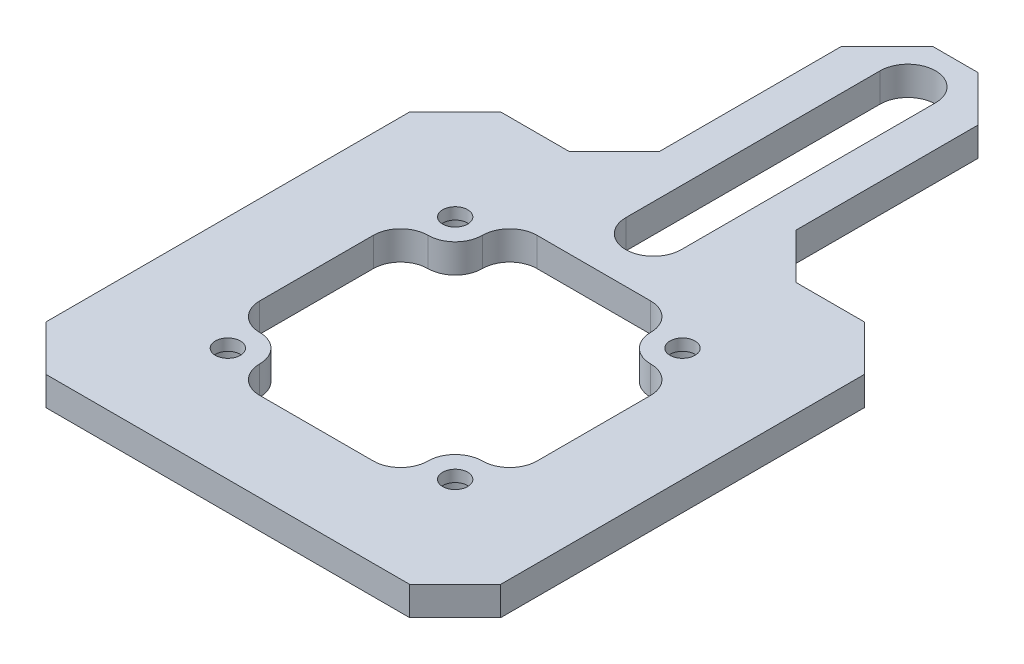
from build123d import *

# Parameters (mm, degrees)
SKETCH2_W           = 50
SKETCH2_H           = 50
BOSS_EXTRUDE1_DEPTH = 3.175
SKETCH3_R           = 1.375
CUT_EXTRUDE1_DEPTH  = 36.497614356
SKETCH5_R           = 2.375
CUT_EXTRUDE3_DEPTH  = 1.9
CUT_EXTRUDE9_DEPTH  = 36.497614356
FILLET1_R           = 3
SKETCH11_W          = 15
SKETCH11_H          = 30
BOSS_EXTRUDE2_DEPTH = 3.175
CUT_EXTRUDE10_REACH = 62.499
CHAMFER1_SIZE       = 5


with BuildPart() as part:
    # Sketch2 → Boss-Extrude1 (new body)
    with BuildSketch(Plane(origin=(0, 0, 0), x_dir=(1, 0, 0), z_dir=(0, 1, 0))):
        Rectangle(SKETCH2_W, SKETCH2_H)
    extrude(amount=BOSS_EXTRUDE1_DEPTH)

    # Sketch3 → Cut-Extrude1 (cut, through all)
    with BuildSketch(Plane(origin=(0, 3.175, 0), x_dir=(1, 0, 0), z_dir=(0, 1, 0))):
        with Locations(Location((12.5, 12.5, 0), (0, 0, 270))):
            Circle(SKETCH3_R)
        with Locations(Location((-12.5, 12.5, 0), (0, 0, 270))):
            Circle(SKETCH3_R)
        with Locations(Location((-12.5, -12.5, 0), (0, 0, 270))):
            Circle(SKETCH3_R)
        with Locations(Location((12.5, -12.5, 0), (0, 0, 270))):
            Circle(SKETCH3_R)
    extrude(amount=-CUT_EXTRUDE1_DEPTH, mode=Mode.SUBTRACT)

    # Sketch5 → Cut-Extrude3 (cut)
    with BuildSketch(Plane.XZ):
        with Locations(Location((12.5, 12.5, 0), (0, 0, 270))):
            Circle(SKETCH5_R)
        with Locations(Location((-12.5, 12.5, 0), (0, 0, 270))):
            Circle(SKETCH5_R)
        with Locations(Location((12.5, -12.5, 0), (0, 0, 270))):
            Circle(SKETCH5_R)
        with Locations(Location((-12.5, -12.5, 0), (0, 0, 270))):
            Circle(SKETCH5_R)
    extrude(amount=-CUT_EXTRUDE3_DEPTH, mode=Mode.SUBTRACT)

    # Sketch10 → Cut-Extrude9 (cut, through all)
    with BuildSketch(Plane.XZ):
        Polygon((-9.25, -15.25), (9.25, -15.25), (9.25, -9.25), (15.25, -9.25), (15.25, 9.25), (9.25, 9.25), (9.25, 15.25), (-9.25, 15.25), (-9.25, 9.25), (-15.25, 9.25), (-15.25, -9.25), (-9.25, -9.25), align=None)
    extrude(amount=-CUT_EXTRUDE9_DEPTH, mode=Mode.SUBTRACT)

    # Fillet1
    fillet1_edges = [part.edges().sort_by_distance(p)[0] for p in [
        (15.25, 1.5875, -9.25),
        (15.25, 1.5875, 9.25),
        (-9.25, 1.5875, -15.25),
        (9.25, 1.5875, -15.25),
        (9.25, 1.5875, 15.25),
        (-9.25, 1.5875, 15.25),
        (-15.25, 1.5875, 9.25),
        (-15.25, 1.5875, -9.25),
        (9.25, 1.5875, 9.25),
        (-9.25, 1.5875, 9.25),
        (9.25, 1.5875, -9.25),
        (-9.25, 1.5875, -9.25),
    ]]
    fillet(fillet1_edges, radius=FILLET1_R - 0.0001)  # a hair under: the kernel refuses the full size

    # Sketch11 → Boss-Extrude2 (add)
    with BuildSketch(Plane(origin=(0, 3.175, 0), x_dir=(1, 0, 0), z_dir=(0, 1, 0))):
        with Locations((0, 40)):
            Rectangle(SKETCH11_W, SKETCH11_H)
    extrude(amount=-BOSS_EXTRUDE2_DEPTH)

    # Sketch13 → Cut-Extrude10 (cut, up to next)
    with BuildSketch(Plane(origin=(0, 3.175, 0), x_dir=(1, 0, 0), z_dir=(0, 1, 0)), mode=Mode.PRIVATE) as cut_extrude10_sk1:
        with BuildLine():
            Line((-3.05, 49.782863058), (-3.05, 21.813452658))
            ThreePointArc((-3.05, 21.813452658), (0, 18.763452658), (3.05, 21.813452658))
            Line((3.05, 21.813452658), (3.05, 49.782863058))
            ThreePointArc((3.05, 49.782863058), (0, 52.832863058), (-3.05, 49.782863058))
        make_face()
    cut_extrude10_tool1 = extrude(cut_extrude10_sk1.sketch, amount=-CUT_EXTRUDE10_REACH, mode=Mode.PRIVATE) & part.part
    add(cut_extrude10_tool1.solids().sort_by_distance((0, 3.175, -35.798158))[0], mode=Mode.SUBTRACT)

    # Chamfer1
    chamfer1_edges = [part.edges().sort_by_distance(p)[0] for p in [
        (7.5, 1.5875, -25),
        (7.5, 1.5875, -55),
        (-7.5, 1.5875, -55),
        (-7.5, 1.5875, -25),
        (25, 1.5875, 25),
        (-25, 1.5875, 25),
        (-25, 1.5875, -25),
        (25, 1.5875, -25),
    ]]
    chamfer(chamfer1_edges, length=CHAMFER1_SIZE)


solid = part.part
